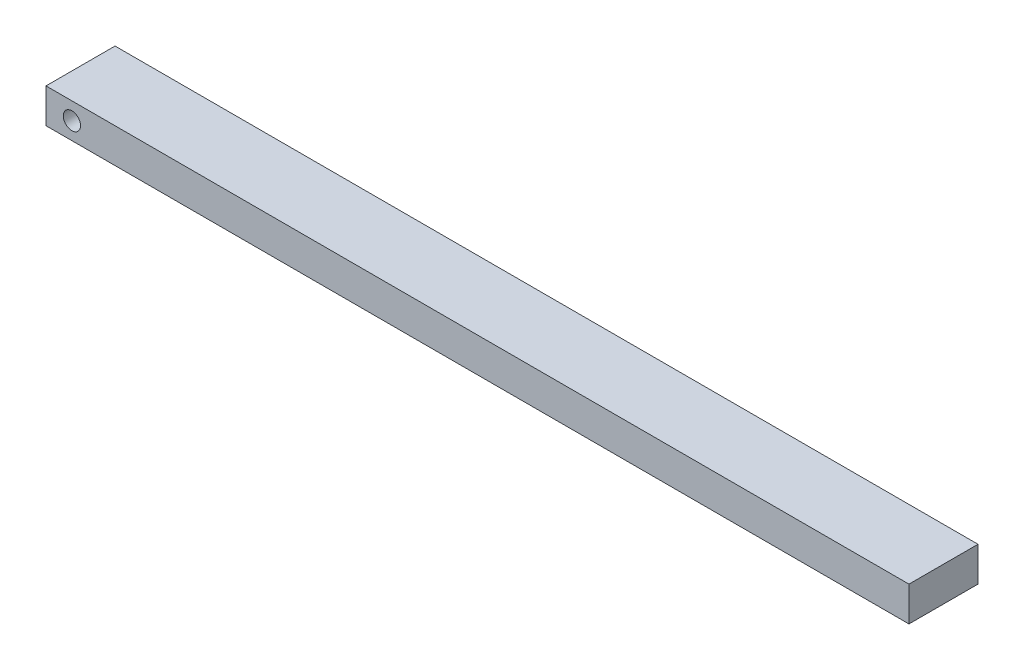
from build123d import *

# Parameters (mm, degrees)
SKETCH1_W           = 500
SKETCH1_H           = 20
SKETCH1_R           = 5
BOSS_EXTRUDE1_DEPTH = 40


with BuildPart() as part:
    # Sketch1 → Boss-Extrude1 (new body)
    with BuildSketch(Plane.XY):
        with Locations((250, 10)):
            Rectangle(SKETCH1_W, SKETCH1_H)
        with Locations((15, 10)):
            Circle(SKETCH1_R, mode=Mode.SUBTRACT)
    extrude(amount=-BOSS_EXTRUDE1_DEPTH)


solid = part.part
